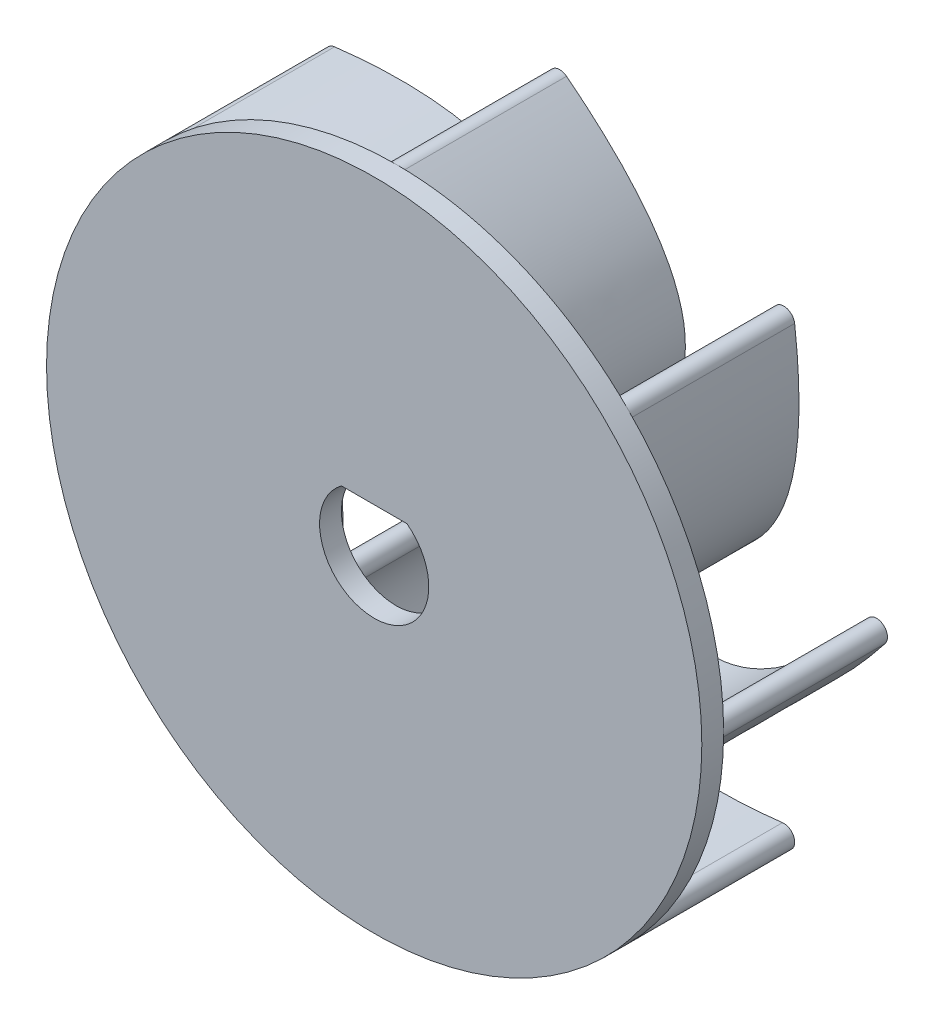
from build123d import *

# Parameters (mm, degrees)
SKETCH_1_R               = 30
EXTRUDE_1_DEPTH          = 2
EXTRUDE_2_DEPTH          = 17
PATTERN_CIRCULAR_1_COUNT = 8


with BuildPart() as part:
    # 草图1 → 凸台-拉伸1 (new body)
    with BuildSketch(Plane.XY):
        Circle(SKETCH_1_R)
        with BuildLine():
            Line((-3, 4), (3, 4))
            ThreePointArc((3, 4), (0, -5), (-3, 4))
        make_face(mode=Mode.SUBTRACT)
    extrude(amount=EXTRUDE_1_DEPTH)

    # 草图2 → 凸台-拉伸2 (add)
    with BuildSketch(Plane.XY.offset(2)):
        with BuildLine():
            ThreePointArc((20.625406451, -21.49895373), (21.49895373, -20.386786858), (20.386786858, -19.513239579))
            add(Edge.make_bspline(
                [(0.965925826, -12.741180955), (1.409497804, -14.382119254), (3.220303095, -16.84907358), (6.509269858, -18.926586642), (13.75866587, -20.299471864), (20.386786858, -19.513239579)],
                knots=[0, 0, 0, 0.1875, 0.375, 0.625, 1, 1, 1], degree=2))
            ThreePointArc((0.965925826, -12.741180955), (-0.258819045, -12.034074174), (-0.965925826, -13.258819045))
            add(Edge.make_bspline(
                [(-0.965925826, -13.258819045), (-0.438926385, -15.240102594), (1.84715244, -18.356470422), (5.852915303, -20.85485807), (13.815097786, -22.327592651), (20.625406451, -21.49895373)],
                knots=[0, 0, 0, 0.1875, 0.375, 0.625, 1, 1, 1], degree=2))
        make_face()
    extrude_2 = extrude(amount=-EXTRUDE_2_DEPTH)

    # 阵列(圆周)1: 凸台-拉伸2 ×8 about axis
    pattern_circular_1_axis = Axis((0, 0, 2), (0, 0, 1))
    for i in range(1, PATTERN_CIRCULAR_1_COUNT):
        add(extrude_2.rotate(pattern_circular_1_axis, i * 360 / PATTERN_CIRCULAR_1_COUNT))


solid = part.part
